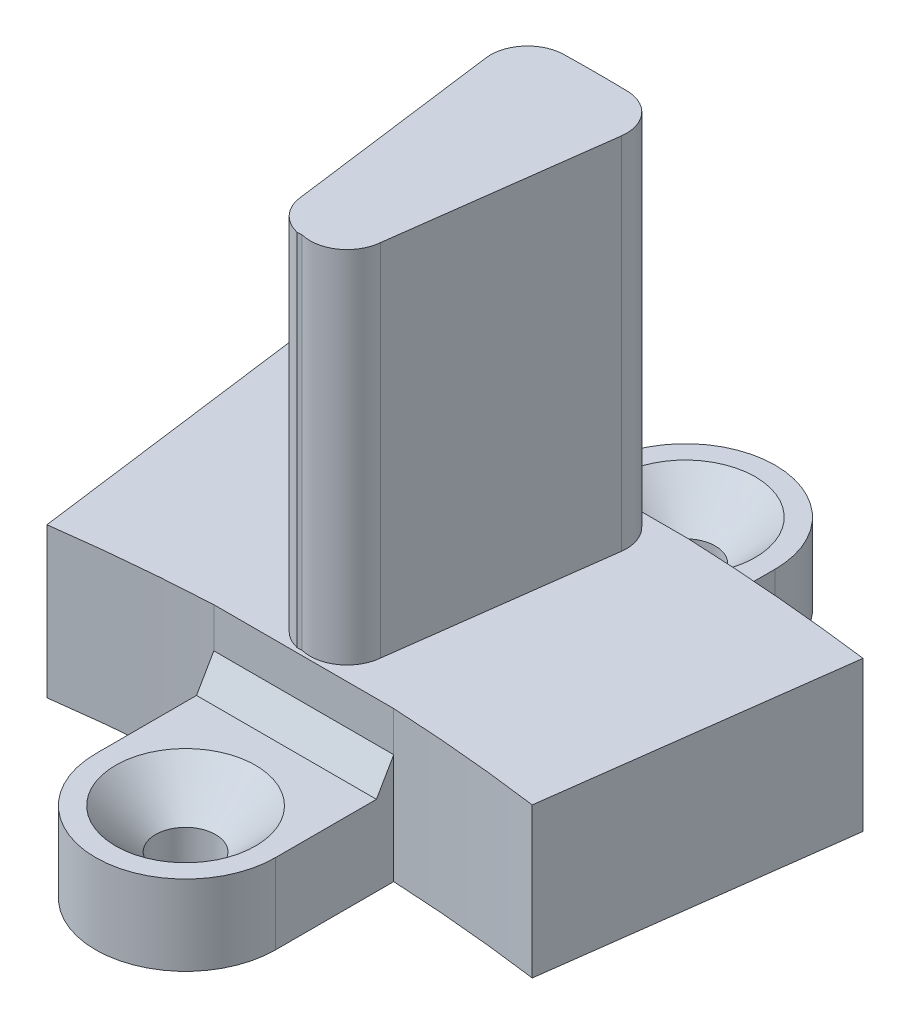
from build123d import *

# Parameters (mm, degrees)
SKETCH1_R                = 1.5
BOSS_EXTRUDE1_DEPTH      = 3.75
BOSS_EXTRUDE2_DEPTH      = 18
BOSS_EXTRUDE2_DEPTH_BACK = 7.5
CUT_EXTRUDE1_DEPTH       = 119.718371128
CUT_EXTRUDE1_DEPTH_BACK  = 3.5
SKETCH4_R                = 1.5
CHAMFER1_SIZE            = 2


with BuildPart() as part:
    # Sketch1 → Boss-Extrude1 (new, symmetric)
    with BuildSketch(Plane(origin=(0, 0, 0), x_dir=(1, 0, 0), z_dir=(0, 1, 0))):
        with BuildLine():
            Line((-14.064197212, 106.828183813), (-12.138935876, 92.204372108))
            ThreePointArc((-12.138935876, 92.204372108), (-8.327034738, 92.640714043), (-4.5, 92.914191088))
            Line((-4.5, 92.914191088), (-4.5, 90.60548378))
            Line((-4.5, 90.60548378), (-4.5, 89.092083998))
            Line((-4.5, 89.092083998), (-4.5, 87))
            ThreePointArc((-4.5, 87), (0, 82.5), (4.5, 87))
            Line((4.5, 87), (4.5, 89.092083998))
            Line((4.5, 89.092083998), (4.5, 90.60548378))
            Line((4.5, 90.60548378), (4.5, 92.914191088))
            ThreePointArc((4.5, 92.914191088), (8.327034738, 92.640714043), (12.138935876, 92.204372108))
            Line((12.138935876, 92.204372108), (14.064197212, 106.828183813))
            ThreePointArc((14.064197212, 106.828183813), (9.290945642, 107.337913445), (4.5, 107.638902983))
            Line((4.5, 107.638902983), (4.5, 109.907916002))
            Line((4.5, 109.907916002), (4.5, 112))
            ThreePointArc((4.5, 112), (0, 116.5), (-4.5, 112))
            Line((-4.5, 112), (-4.5, 109.907916002))
            Line((-4.5, 109.907916002), (-4.5, 107.638902983))
            ThreePointArc((-4.5, 107.638902983), (-9.290945642, 107.337913445), (-14.064197212, 106.828183813))
        make_face()
        with Locations(Location((0, 112, 0), (0, 0, 270))):
            Circle(SKETCH1_R, mode=Mode.SUBTRACT)
        with Locations(Location((0, 87, 0), (0, 0, 90))):
            Circle(SKETCH1_R, mode=Mode.SUBTRACT)
    extrude(amount=BOSS_EXTRUDE1_DEPTH, both=True)

    # Sketch3 → Boss-Extrude2 (add, two sides: drawn at the far end of the back side and taken through both)
    with BuildSketch(Plane(origin=(0, 3.75, 0), x_dir=(1, 0, 0), z_dir=(0, 1, 0)).offset(-BOSS_EXTRUDE2_DEPTH_BACK)):
        with BuildLine():
            Line((1.982080861, 94.766924481), (3.385996272, 105.430720736))
            ThreePointArc((3.385996272, 105.430720736), (2.964387866, 106.850395337), (1.636401853, 107.505897258))
            ThreePointArc((1.636401853, 107.505897258), (0, 107.524356631), (-1.636401853, 107.505897258))
            ThreePointArc((-1.636401853, 107.505897258), (-2.964387866, 106.850395337), (-3.385996272, 105.430720736))
            Line((-3.385996272, 105.430720736), (-1.982080861, 94.766924481))
            ThreePointArc((-1.982080861, 94.766924481), (-1.531449923, 93.718749438), (-0.551584549, 93.134281295))
            ThreePointArc((-0.551584549, 93.134281295), (-0.433742315, 93.139694116), (-0.315893802, 93.144968474))
            ThreePointArc((-0.315893802, 93.144968474), (1.206800808, 93.426480911), (1.982080861, 94.766924481))
        make_face()
    extrude(amount=BOSS_EXTRUDE2_DEPTH + BOSS_EXTRUDE2_DEPTH_BACK)

    # Sketch4 → Cut-Extrude1 (cut, two sides: drawn at the far end of the back side and taken through both)
    # profile 1 of 2: a face of its own
    with BuildSketch(Plane(origin=(0, 3.75, 0), x_dir=(1, 0, 0), z_dir=(0, 1, 0)).offset(-CUT_EXTRUDE1_DEPTH_BACK)):
        with BuildLine():
            Line((-4.5, 91.393652938), (-4.5, 87.032555921))
            ThreePointArc((-4.5, 87.032555921), (0, 82.41632562), (4.5, 87.032555921))
            Line((4.5, 87.032555921), (4.5, 91.393652938))
            Line((4.5, 91.393652938), (4.5, 92.914191088))
            Line((4.5, 92.914191088), (-4.5, 92.914191088))
            Line((-4.5, 92.914191088), (-4.5, 91.393652938))
        make_face()
        with Locations(Location((0, 87, 0), (0, 0, 90))):
            Circle(SKETCH4_R, mode=Mode.SUBTRACT)
    # profile 2 of 2: a face of its own
    with BuildSketch(Plane(origin=(0, 3.75, 0), x_dir=(1, 0, 0), z_dir=(0, 1, 0)).offset(-CUT_EXTRUDE1_DEPTH_BACK)):
        with BuildLine():
            Line((4.5, 107.638902983), (-4.5, 107.638902983))
            Line((-4.5, 107.638902983), (-4.5, 112))
            ThreePointArc((-4.5, 112), (0, 116.5), (4.5, 112))
            Line((4.5, 112), (4.5, 107.638902983))
        make_face()
        with Locations(Location((0, 112, 0), (0, 0, 270))):
            Circle(SKETCH4_R, mode=Mode.SUBTRACT)
    extrude(amount=CUT_EXTRUDE1_DEPTH + CUT_EXTRUDE1_DEPTH_BACK, mode=Mode.SUBTRACT)

    # Chamfer1
    chamfer1_edges = [part.edges().sort_by_distance(p)[0] for p in [
        (0, 0.25, -85.5),
        (0, 0.25, -113.5),
    ]]
    chamfer(chamfer1_edges, length=CHAMFER1_SIZE)

    # Chamfer2
    # the kernel refuses this chamfer: 1.5, 0.866025404 mm, written as the material it adds along each edge
    with BuildSketch(Plane(origin=(4.5, 0.25, -107.638902983), x_dir=(-1.576335496707441e-15, -0.057893862402670165, -0.9983227437537927), z_dir=(-1, 0, 0))) as chamfer2_piece_1:
        with BuildLine():
            Line((0.897530793, 0), (-0.119798729, -1.547621671))
            Line((-0.119798729, -1.547621671), (-0.149748412, -1.545884855))
            ThreePointArc((-0.149748412, -1.545884855), (-0.074874206, -0.772942428), (-0.029949682, 0.001736816))
            Line((-0.029949682, 0.001736816), (0.001736816, 0.029949682))
            ThreePointArc((0.001736816, 0.029949682), (0.448998086, 0.004012497), (0.899267609, 0.029949682))
            Line((0.899267609, 0.029949682), (0.897530793, 0))
        make_face()
    extrude(amount=9)
    with BuildSketch(Plane(origin=(4.5, 0.25, -92.914191088), x_dir=(0, 0.9998132206222078, -0.019326765612701434), z_dir=(-1, 0, 0))) as chamfer2_piece_2_section:
        with BuildLine():
            Line((1.552251453, 0), (-0.069269092, -0.894853797))
            Line((-0.069269092, -0.894853797), (-0.099263488, -0.894273994))
            ThreePointArc((-0.099263488, -0.894273994), (-0.038653033, -0.447349219), (-0.029994397, 0.000579803))
            Line((-0.029994397, 0.000579803), (0.000579803, 0.029994397))
            ThreePointArc((0.000579803, 0.029994397), (0.776415628, 0.014997198), (1.552831256, 0.029994397))
            Line((1.552831256, 0.029994397), (1.552251453, 0))
        make_face()
    chamfer2_piece_2 = extrude(amount=9, mode=Mode.PRIVATE)
    chamfer2_piece_2 = chamfer2_piece_2 & Plane(origin=(0, 0.749739916, -3.026761488), x_dir=(-0.13487706529406074, 0, -0.9908623402156638), z_dir=(0, 1, 0)) * Cylinder(90, 25, mode=Mode.PRIVATE)
    add(chamfer2_piece_2)


solid = part.part
